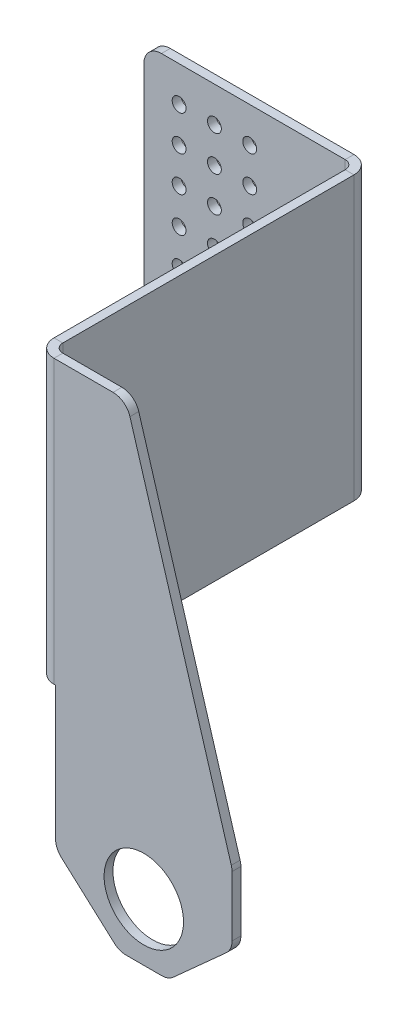
from build123d import *

# Parameters (mm, degrees)
SKETCH1_R           = 2.4892
SKETCH1_R_2         = 14.2875
BOSS_EXTRUDE1_DEPTH = 3.175
JOG1_START          = -71.4375
JOG1_DEPTH          = 173.0375
JOG1_2_DEPTH        = 101.6
JOG1_START_2        = -36.5124999
JOG1_3_OUTLINE_W    = 63.5
JOG1_3_OUTLINE_H    = 3.175
JOG1_3_DEPTH        = 11.1124999
JOG1_START_3        = 114.3
JOG1_4_OUTLINE_R    = 14.2875
JOG1_4_DEPTH        = 3.175
FILLET2_R           = 6.35


with BuildPart() as part:
    # Sketch1 → Boss-Extrude1 (new body)
    with BuildSketch(Plane.XY):
        Polygon((0, 0), (82.55, 0), (82.55, -50.8), (105.480555556, -71.4375), (123.119444444, -71.4375), (146.05, -50.8), (146.05, -25.4), (107.95, 101.6), (0, 101.6), align=None)
        with Locations((12.7, 12.7)):
            Circle(SKETCH1_R, mode=Mode.SUBTRACT)
        with Locations((25.4, 12.7)):
            Circle(SKETCH1_R, mode=Mode.SUBTRACT)
        with Locations((38.1, 12.7)):
            Circle(SKETCH1_R, mode=Mode.SUBTRACT)
        with Locations((12.7, 25.4)):
            Circle(SKETCH1_R, mode=Mode.SUBTRACT)
        with Locations((25.4, 25.4)):
            Circle(SKETCH1_R, mode=Mode.SUBTRACT)
        with Locations((12.7, 38.1)):
            Circle(SKETCH1_R, mode=Mode.SUBTRACT)
        with Locations((12.7, 50.8)):
            Circle(SKETCH1_R, mode=Mode.SUBTRACT)
        with Locations((25.4, 38.1)):
            Circle(SKETCH1_R, mode=Mode.SUBTRACT)
        with Locations((25.4, 50.8)):
            Circle(SKETCH1_R, mode=Mode.SUBTRACT)
        with Locations((38.1, 25.4)):
            Circle(SKETCH1_R, mode=Mode.SUBTRACT)
        with Locations((38.1, 38.1)):
            Circle(SKETCH1_R, mode=Mode.SUBTRACT)
        with Locations((38.1, 50.8)):
            Circle(SKETCH1_R, mode=Mode.SUBTRACT)
        with Locations((12.7, 63.5)):
            Circle(SKETCH1_R, mode=Mode.SUBTRACT)
        with Locations((12.7, 76.2)):
            Circle(SKETCH1_R, mode=Mode.SUBTRACT)
        with Locations((25.4, 63.5)):
            Circle(SKETCH1_R, mode=Mode.SUBTRACT)
        with Locations((25.4, 76.2)):
            Circle(SKETCH1_R, mode=Mode.SUBTRACT)
        with Locations((12.7, 88.9)):
            Circle(SKETCH1_R, mode=Mode.SUBTRACT)
        with Locations((25.4, 88.9)):
            Circle(SKETCH1_R, mode=Mode.SUBTRACT)
        with Locations((38.1, 63.5)):
            Circle(SKETCH1_R, mode=Mode.SUBTRACT)
        with Locations((38.1, 76.2)):
            Circle(SKETCH1_R, mode=Mode.SUBTRACT)
        with Locations((38.1, 88.9)):
            Circle(SKETCH1_R, mode=Mode.SUBTRACT)
        with Locations((114.3, -50.8)):
            Circle(SKETCH1_R_2, mode=Mode.SUBTRACT)
    extrude(amount=BOSS_EXTRUDE1_DEPTH)

    # Jog1: read off the stored shape, not the designer's step
    # Jog1 outline → Jog1 (cut)
    with BuildSketch(Plane(origin=(0, 0, 0), x_dir=(1, 0, 0), z_dir=(0, 1, 0)).offset(JOG1_START)):
        with BuildLine():
            ThreePointArc((72.459541247, 0), (75.634541247, -0.850738686), (77.958802561, -3.175))
            Line((77.958802561, -3.175), (146.05, -3.175))
            Line((146.05, -3.175), (146.05, 0))
            Line((146.05, 0), (72.459541247, 0))
        make_face()
    extrude(amount=JOG1_DEPTH, mode=Mode.SUBTRACT)

    # Jog1 2 outline → Jog1 2 (add)
    with BuildSketch(Plane(origin=(0, 0, 0), x_dir=(1, 0, 0), z_dir=(0, 1, 0))):
        with BuildLine():
            ThreePointArc((72.459541247, -3.175), (74.704605277, -4.10493597), (75.634541247, -6.35))
            Line((75.634541247, -6.35), (75.634541247, -111.125))
            ThreePointArc((75.634541247, -111.125), (77.494413186, -115.615128061), (81.984541247, -117.475))
            Line((81.984541247, -117.475), (82.55, -117.475))
            Line((82.55, -117.475), (82.55, -114.3))
            Line((82.55, -114.3), (81.984541247, -114.3))
            ThreePointArc((81.984541247, -114.3), (79.739477217, -113.37006403), (78.809541247, -111.125))
            Line((78.809541247, -111.125), (78.809541247, -6.35))
            ThreePointArc((78.809541247, -6.35), (78.593170244, -4.706499064), (77.958802561, -3.175))
            Line((77.958802561, -3.175), (72.459541247, -3.175))
        make_face()
    extrude(amount=JOG1_2_DEPTH)



with BuildPart() as body_2:
    # Jog1 3 outline → Jog1 3 (new body)
    with BuildSketch(Plane(origin=(0, 0, 0), x_dir=(1, 0, 0), z_dir=(0, 1, 0)).offset(JOG1_START_2)):
        with Locations((114.3, -115.8875)):
            Rectangle(JOG1_3_OUTLINE_W, JOG1_3_OUTLINE_H)
    extrude(amount=JOG1_3_DEPTH)


with BuildPart() as part_1:
    add(part.part)

    add(body_2.part)  # Jog1 4 merges body 2
    # Jog1 4 outline → Jog1 4 (add)
    with BuildSketch(Plane.XY.offset(JOG1_START_3)):
        Polygon((107.95, 101.6), (81.984541247, 101.6), (81.984541247, 0), (82.55, 0), (82.55, -50.8), (105.480555556, -71.4375), (123.119444444, -71.4375), (146.05, -50.8), (146.05, -25.4), align=None)
        with Locations((114.3, -50.8)):
            Circle(JOG1_4_OUTLINE_R, mode=Mode.SUBTRACT)
    extrude(amount=JOG1_4_DEPTH)

    # Fillet2
    fillet2_edges = [part_1.edges().sort_by_distance(p)[0] for p in [
        (0, 0, 1.5875),
        (0, 101.6, 1.5875),
        (107.95, 101.6, 115.8875),
        (146.05, -25.4, 115.8875),
        (146.05, -50.8, 115.8875),
        (123.119444444, -71.4375, 115.8875),
        (105.480555556, -71.4375, 115.8875),
        (82.55, -50.8, 115.8875),
    ]]
    fillet(fillet2_edges, radius=FILLET2_R)


solid = part_1.part
